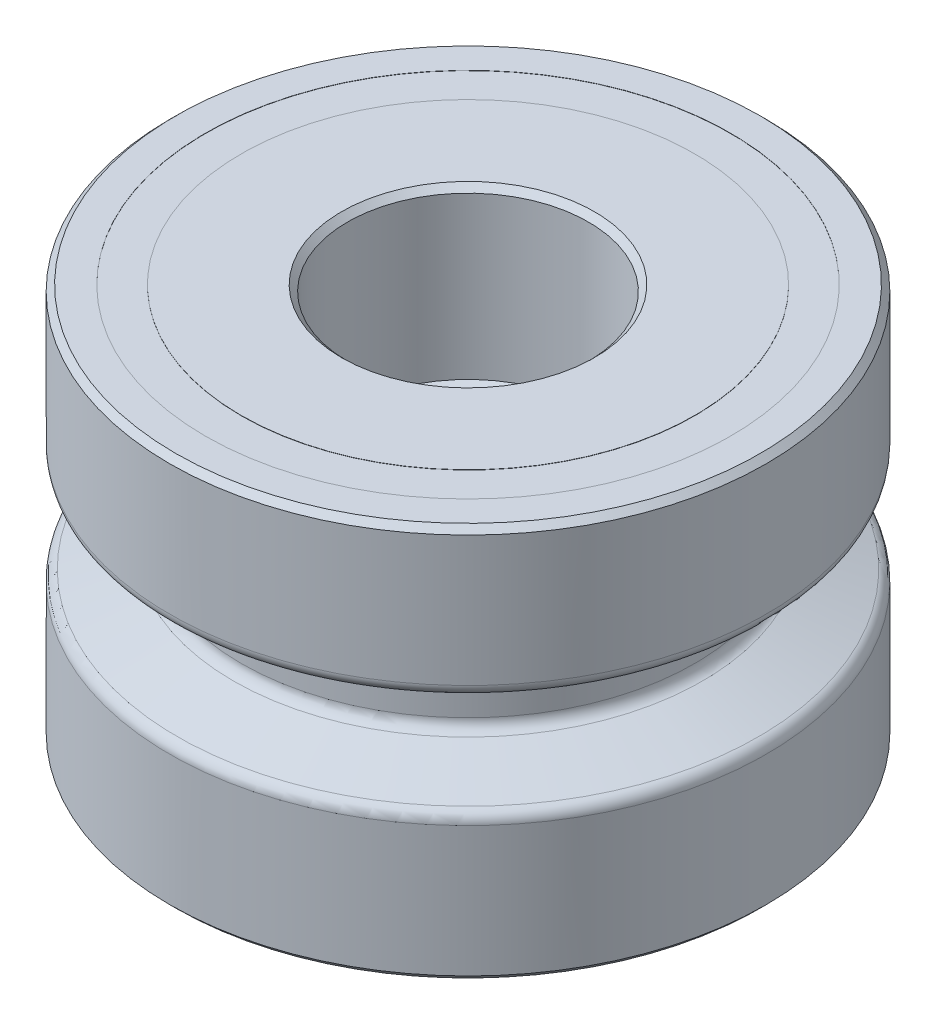
from build123d import *

# Parameters (mm, degrees)
SKETCH1_R           = 12.5
BOSS_EXTRUDE1_DEPTH = 8.25
CUT_EXTRUDE1_REACH  = 26.182
SKETCH2_R           = 4
SKETCH11_R          = 5.05
CUT_EXTRUDE5_DEPTH  = 4
CUT_EXTRUDE6_START  = -7
SKETCH12_R          = 5.05
CUT_EXTRUDE6_DEPTH  = 7
SKETCH7_R           = 11
SKETCH7_R_2         = 9.5
CUT_EXTRUDE4_DEPTH  = 0.01
CHAMFER2_SIZE       = 0.5
CHAMFER2_SIZE_2     = 1.07225346
FILLET4_R           = 0.5
CHAMFER1_SIZE       = 0.25


with BuildPart() as part:
    # Sketch1 → Boss-Extrude1 (new, symmetric)
    with BuildSketch(Plane(origin=(0, 0, 0), x_dir=(1, 0, 0), z_dir=(0, 1, 0))):
        with Locations(Location((0, 0, 0), (0, 0, 270))):
            Circle(SKETCH1_R)
    extrude(amount=BOSS_EXTRUDE1_DEPTH, both=True)

    # Sketch2 → Cut-Extrude1 (cut, up to next)
    with BuildSketch(Plane.XZ.offset(8.25), mode=Mode.PRIVATE) as cut_extrude1_sk1:
        with Locations(Location((0, 0, 0), (0, 0, 270))):
            Circle(SKETCH2_R)
    cut_extrude1_tool1 = extrude(cut_extrude1_sk1.sketch, amount=-CUT_EXTRUDE1_REACH, mode=Mode.PRIVATE) & part.part
    add(cut_extrude1_tool1.solids().sort_by_distance((0, -8.25, 0))[0], mode=Mode.SUBTRACT)

    # Sketch11 → Cut-Extrude5 (cut)
    with BuildSketch(Plane.XZ.offset(8.25)):
        with Locations(Location((0, 0, 0), (0, 0, 270))):
            Circle(SKETCH11_R)
    extrude(amount=-CUT_EXTRUDE5_DEPTH, mode=Mode.SUBTRACT)

    # Sketch12 → Cut-Extrude6 (cut)
    with BuildSketch(Plane(origin=(0, 8.25, 0), x_dir=(1, 0, 0), z_dir=(0, 1, 0)).offset(CUT_EXTRUDE6_START)):
        with Locations(Location((0, 0, 0), (0, 0, 90))):
            Circle(SKETCH12_R)
    extrude(amount=CUT_EXTRUDE6_DEPTH, mode=Mode.SUBTRACT)

    # Sketch7 → Cut-Extrude4 (cut)
    with BuildSketch(Plane(origin=(0, 8.25, 0), x_dir=(1, 0, 0), z_dir=(0, 1, 0))):
        with Locations(Location((0, 0, 0), (0, 0, 270))):
            Circle(SKETCH7_R)
        with Locations(Location((0, 0, 0), (0, 0, 270))):
            Circle(SKETCH7_R_2, mode=Mode.SUBTRACT)
    extrude(amount=-CUT_EXTRUDE4_DEPTH, mode=Mode.SUBTRACT)

    # Sketch10 → Cut-Revolve1 (revolve, cut)
    with BuildSketch(Plane.XY, mode=Mode.PRIVATE) as cut_revolve1_sk:
        Polygon((12.5, 2.191910703), (9.5, 1.1), (9.5, -1.1), (12.5, -2.191910703), align=None)
    revolve(cut_revolve1_sk.sketch.rotate(Axis((0, 8.25, 0), (0, -1, 0)), 90), axis=Axis((0, 8.25, 0), (0, -1, 0)), mode=Mode.SUBTRACT)

    # Chamfer2
    # the kernel refuses this chamfer: 1.07225346, 0.5 mm, written as the material it takes off along each edge
    with BuildSketch(Plane(origin=(0, 1.25, 0), x_dir=(0, 0, -1), z_dir=(-1, 0, 0))) as chamfer2_piece_1_section:
        Polygon((4, CHAMFER2_SIZE), (4 + CHAMFER2_SIZE_2, 0), (4, 0), align=None)
    chamfer2_piece_1 = revolve(axis=Axis((0, 1.25, 0), (0, -1, 0)), mode=Mode.PRIVATE)
    chamfer2_piece_1 = chamfer2_piece_1 & Plane(origin=(0, 1.004178962, 0), x_dir=(0, 0, -1), z_dir=(0, -1, 0)) * Cylinder(5.05, 21, mode=Mode.PRIVATE)
    add(chamfer2_piece_1, mode=Mode.SUBTRACT)

    # Fillet4
    fillet4_edges = [part.edges().sort_by_distance(p)[0] for p in [
        (0, -2.191910703, -12.5),
        (0, -1.1, -9.5),
        (0, 1.1, -9.5),
        (0, 2.191910703, -12.5),
    ]]
    fillet(fillet4_edges, radius=FILLET4_R)

    # Chamfer1
    chamfer1_edges = [part.edges().sort_by_distance(p)[0] for p in [
        (0, -8.25, 5.05),
        (0, -4.25, 4),
        (0, 8.25, 5.05),
        (0, -8.25, -12.5),
        (0, 8.25, -12.5),
    ]]
    chamfer(chamfer1_edges, length=CHAMFER1_SIZE)


solid = part.part
